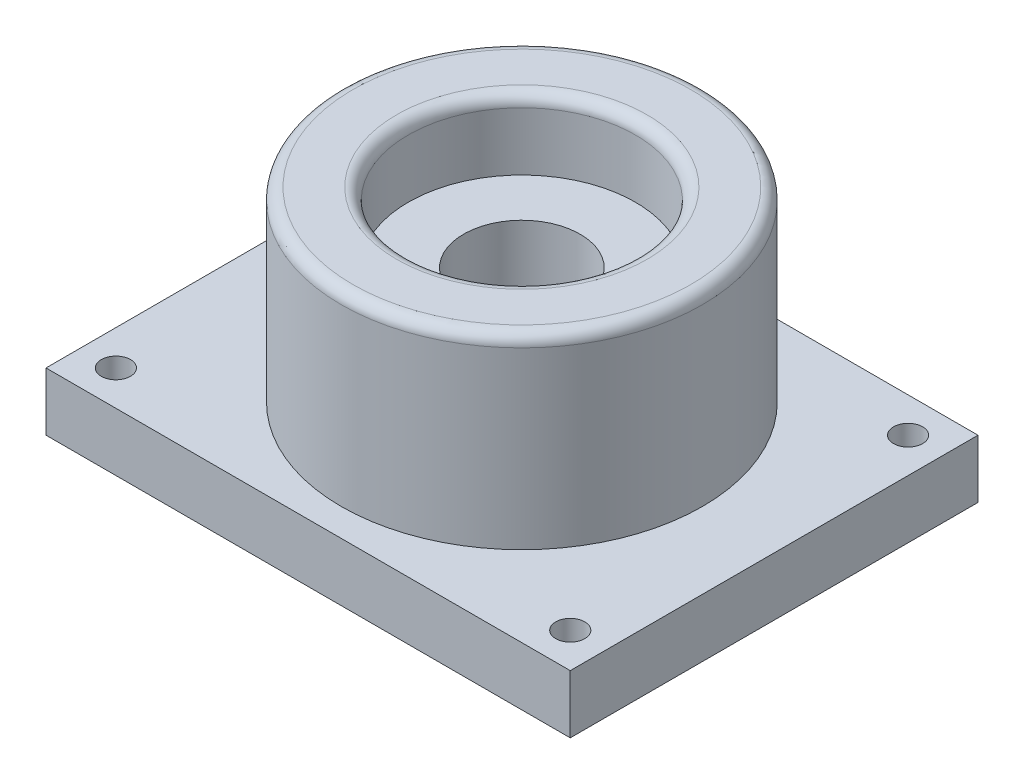
from build123d import *

# Parameters (mm, degrees)
SKETCH1_R           = 15.5
BOSS_EXTRUDE1_DEPTH = 16
SKETCH16_W          = 45
SKETCH16_H          = 35
SKETCH16_R          = 1.25
BOSS_EXTRUDE6_DEPTH = 5
SKETCH17_R          = 9.75
CUT_EXTRUDE5_DEPTH  = 6
SKETCH18_R          = 5
CUT_EXTRUDE7_DEPTH  = 19
FILLET1_R           = 1
FILLET3_R           = 1


with BuildPart() as part:
    # Sketch1 → Boss-Extrude1 (new body)
    with BuildSketch(Plane(origin=(0, 0, 0), x_dir=(1, 0, 0), z_dir=(0, 1, 0))):
        Circle(SKETCH1_R)
    extrude(amount=BOSS_EXTRUDE1_DEPTH)

    # Sketch16 → Boss-Extrude6 (add)
    with BuildSketch(Plane.XZ):
        with Locations((-0.475800023, 0.370066685)):
            Rectangle(SKETCH16_W, SKETCH16_H)
        with Locations((-19.975800023, -14.129933315)):
            Circle(SKETCH16_R, mode=Mode.SUBTRACT)
        with Locations((19.024199977, -14.129933315)):
            Circle(SKETCH16_R, mode=Mode.SUBTRACT)
        with Locations((19.024199977, 14.870066685)):
            Circle(SKETCH16_R, mode=Mode.SUBTRACT)
        with Locations((-19.975800023, 14.870066685)):
            Circle(SKETCH16_R, mode=Mode.SUBTRACT)
    extrude(amount=BOSS_EXTRUDE6_DEPTH)

    # Sketch17 → Cut-Extrude5 (cut)
    with BuildSketch(Plane(origin=(0, 16, 0), x_dir=(1, 0, 0), z_dir=(0, 1, 0))):
        Circle(SKETCH17_R)
    extrude(amount=-CUT_EXTRUDE5_DEPTH, mode=Mode.SUBTRACT)

    # Sketch18 → Cut-Extrude7 (cut)
    with BuildSketch(Plane(origin=(0, 10, 0), x_dir=(1, 0, 0), z_dir=(0, 1, 0))):
        Circle(SKETCH18_R)
    extrude(amount=-CUT_EXTRUDE7_DEPTH, mode=Mode.SUBTRACT)

    # Fillet1
    fillet1_edges = [part.edges().sort_by_distance(p)[0] for p in [
        (-9.75, 16, 0),
    ]]
    fillet(fillet1_edges, radius=FILLET1_R)

    # Fillet3
    fillet3_edges = [part.edges().sort_by_distance(p)[0] for p in [
        (-15.5, 16, 0),
    ]]
    fillet(fillet3_edges, radius=FILLET3_R)


solid = part.part
